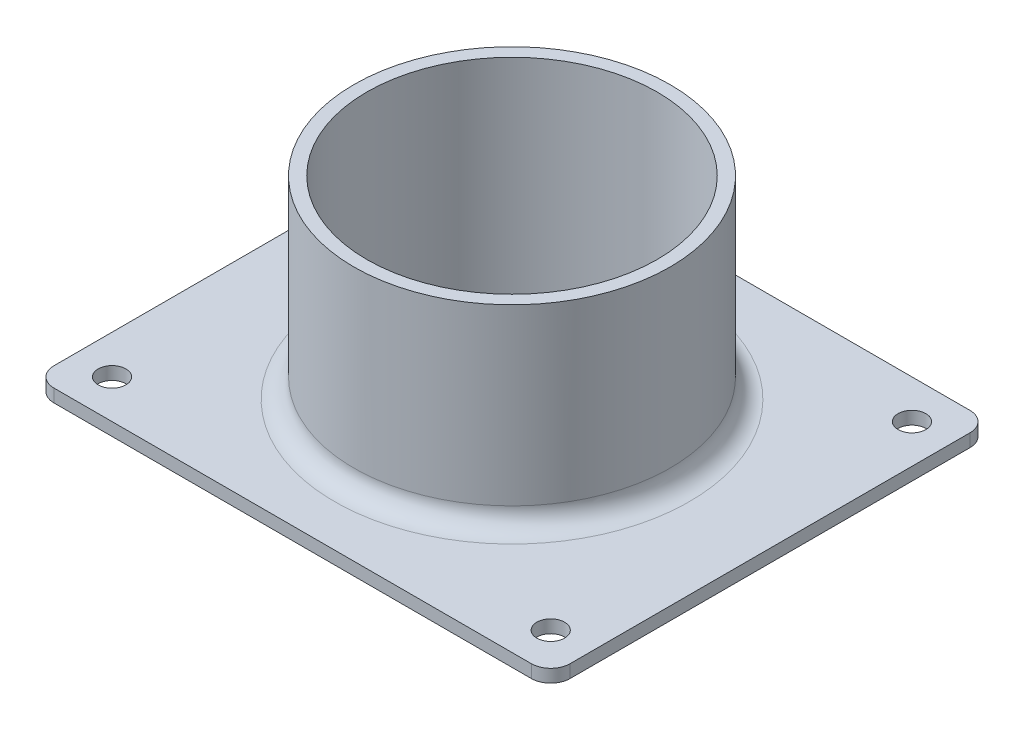
from build123d import *

# Parameters (mm, degrees)
SKETCH1_W           = 80
SKETCH1_H           = 68
SKETCH1_R           = 22.5
SKETCH1_R_2         = 2.15
BOSS_EXTRUDE1_DEPTH = 2
SKETCH2_R           = 24.5
SKETCH2_R_2         = 22.5
BOSS_EXTRUDE2_DEPTH = 30
FILLET1_R           = 3
FILLET2_R           = 3


with BuildPart() as part:
    # Sketch1 → Boss-Extrude1 (new body)
    with BuildSketch(Plane(origin=(0, 0, 0), x_dir=(1, 0, 0), z_dir=(0, 1, 0))):
        Rectangle(SKETCH1_W, SKETCH1_H)
        Circle(SKETCH1_R, mode=Mode.SUBTRACT)
        with Locations((34, 28)):
            Circle(SKETCH1_R_2, mode=Mode.SUBTRACT)
        with Locations((34, -28)):
            Circle(SKETCH1_R_2, mode=Mode.SUBTRACT)
        with Locations((-34, -28)):
            Circle(SKETCH1_R_2, mode=Mode.SUBTRACT)
        with Locations((-34, 28)):
            Circle(SKETCH1_R_2, mode=Mode.SUBTRACT)
    extrude(amount=BOSS_EXTRUDE1_DEPTH)

    # Sketch2 → Boss-Extrude2 (add)
    with BuildSketch(Plane(origin=(0, 2, 0), x_dir=(1, 0, 0), z_dir=(0, 1, 0))):
        Circle(SKETCH2_R)
        Circle(SKETCH2_R_2, mode=Mode.SUBTRACT)
    extrude(amount=BOSS_EXTRUDE2_DEPTH)

    # Fillet1
    fillet1_edges = [part.edges().sort_by_distance(p)[0] for p in [
        (-24.5, 2, 0),
    ]]
    fillet(fillet1_edges, radius=FILLET1_R)

    # Fillet2
    fillet2_edges = [part.edges().sort_by_distance(p)[0] for p in [
        (40, 1, -34),
        (40, 1, 34),
        (-40, 1, 34),
        (-40, 1, -34),
    ]]
    fillet(fillet2_edges, radius=FILLET2_R)


solid = part.part
